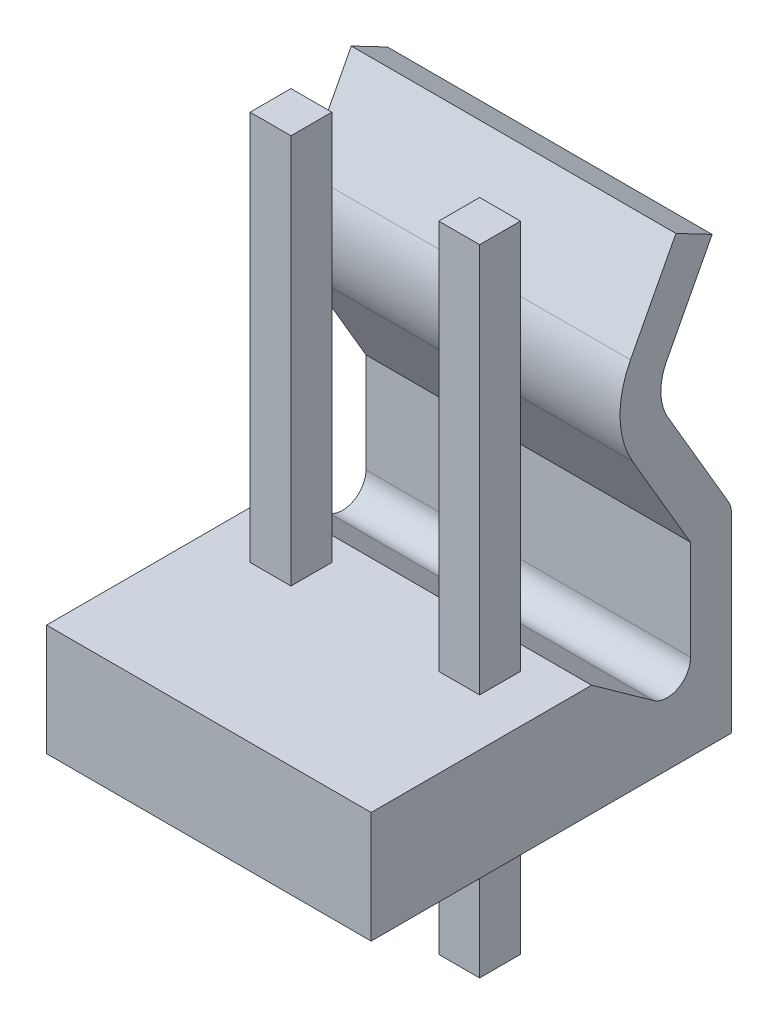
from build123d import *

# Parameters (mm, degrees)
CROQUIS1_W                   = 8.74
CROQUIS1_H                   = 9.7
CROQUIS1_W_2                 = 1.1
CROQUIS1_H_2                 = 1.1
SALIENTE_EXTRUIR1_DEPTH      = 3
CROQUIS2_W                   = 8.74
CROQUIS2_H                   = 3
SALIENTE_EXTRUIR2_DEPTH      = 9.4
CORTAR_EXTRUIR1_DEPTH        = 9
SALIENTE_EXTRUIR3_DEPTH      = 13.5
SALIENTE_EXTRUIR3_DEPTH_BACK = 3.6
CROQUIS5_W                   = 1.1
CROQUIS5_H                   = 1.1


with BuildPart() as part:
    # Croquis1 → Saliente-Extruir1 (new body)
    with BuildSketch(Plane(origin=(0, 0, 0), x_dir=(1, 0, 0), z_dir=(0, 1, 0))):
        with Locations((2.54, 0.1)):
            Rectangle(CROQUIS1_W, CROQUIS1_H)
        Rectangle(CROQUIS1_W_2, CROQUIS1_H_2, mode=Mode.SUBTRACT)
        with Locations((5.08, 0)):
            Rectangle(CROQUIS1_W_2, CROQUIS1_H_2, mode=Mode.SUBTRACT)
    extrude(amount=SALIENTE_EXTRUIR1_DEPTH)

    # Croquis2 → Saliente-Extruir2 (add)
    with BuildSketch(Plane(origin=(0, 3, 0), x_dir=(1, 0, 0), z_dir=(0, 1, 0))):
        with Locations((2.54, 3.45)):
            Rectangle(CROQUIS2_W, CROQUIS2_H)
    extrude(amount=SALIENTE_EXTRUIR2_DEPTH)

    # Croquis3 → Cortar-Extruir1 (cut)
    with BuildSketch(Plane.ZY.offset(1.83)):
        with BuildLine():
            Line((-1.95, 3), (-1.95, 8.9155089))
            ThreePointArc((-1.95, 8.9155089), (-2.036358841, 8.267369623), (-2.28940975, 7.664453701))
            Line((-2.28940975, 7.664453701), (-3.85, 5))
            Line((-3.85, 5), (-3.85, 2.319959731))
            ThreePointArc((-3.85, 2.319959731), (-3.508458272, 1.760049187), (-2.854318236, 1.807497933))
            Line((-2.854318236, 1.807497933), (-1.184444515, 3))
            Line((-1.184444515, 3), (-1.95, 3))
        make_face()
        with BuildLine():
            Line((-1.95, 12.4), (-3.455311447, 12.4))
            Line((-3.455311447, 12.4), (-2.232277415, 10.063467416))
            ThreePointArc((-2.232277415, 10.063467416), (-2.021605007, 9.506586156), (-1.95, 8.9155089))
            Line((-1.95, 8.9155089), (-1.95, 12.4))
        make_face()
        with BuildLine():
            Line((-4.95, 12.4), (-4.95, 5.130923429))
            ThreePointArc((-4.95, 5.130923429), (-4.928460036, 5.292584893), (-4.865343077, 5.442966568))
            Line((-4.865343077, 5.442966568), (-3.238584298, 8.220392257))
            ThreePointArc((-3.238584298, 8.220392257), (-3.050389859, 8.882763545), (-3.206840185, 9.553342522))
            Line((-3.206840185, 9.553342522), (-4.429874218, 11.889875107))
            Line((-4.429874218, 11.889875107), (-3.455311447, 12.4))
            Line((-3.455311447, 12.4), (-4.95, 12.4))
        make_face()
    extrude(amount=-CORTAR_EXTRUIR1_DEPTH, mode=Mode.SUBTRACT)

    # Croquis5 → Saliente-Extruir3 (add, two sides: drawn at the far end of the back side and taken through both)
    with BuildSketch(Plane(origin=(0, 0, 0), x_dir=(1, 0, 0), z_dir=(0, 1, 0)).offset(-SALIENTE_EXTRUIR3_DEPTH_BACK)):
        with Locations((5.08, 0)):
            Rectangle(CROQUIS5_W, CROQUIS5_H)
        Rectangle(CROQUIS5_W, CROQUIS5_H)
    extrude(amount=SALIENTE_EXTRUIR3_DEPTH + SALIENTE_EXTRUIR3_DEPTH_BACK)


solid = part.part
